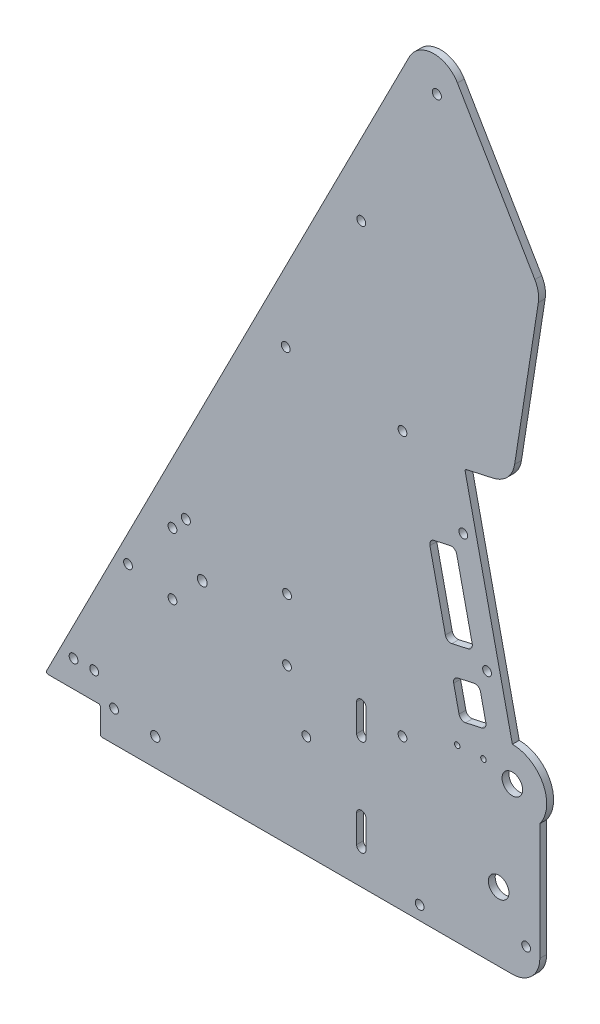
from build123d import *

# Parameters (mm, degrees)
BOSS_EXTRUDE1_DEPTH     = 3.175
SKETCH2_R               = 2.0955
SKETCH2_R_2             = 2.286
SKETCH2_R_3             = 2.032
SKETCH2_R_4             = 4.7625
CUT_EXTRUDE1_DEPTH      = 421.976111717
SKETCH7_R               = 2.159
CUT_EXTRUDE2_DEPTH      = 421.976111717
CUT_EXTRUDE3_REACH      = 422.976
SKETCH10_R              = 2.032
FILLET1_R               = 12.7
FILLET2_R               = 0.79375
SKETCH12_R              = 2.032
CUT_EXTRUDE5_DEPTH      = 410.593447353
SKETCH13_R              = 2.032
CUT_EXTRUDE6_DEPTH      = 410.593447353
CUT_EXTRUDE7_DEPTH      = 410.593447353
CUT_EXTRUDE7_DEPTH_BACK = 410.593447353
SKETCH14_R              = 1.27
FILLET3_R               = 2.54


with BuildPart() as part:
    # Sketch1 → Boss-Extrude1 (new body)
    with BuildSketch(Plane.XY):
        with BuildLine():
            Line((228.6, -12.7), (228.6, 53.975))
            ThreePointArc((228.6, 53.975), (230.099031657, 70.599515829), (215.9, 79.375))
            Line((215.9, 79.375), (193.909735224, 178.566674323))
            Line((193.909735224, 178.566674323), (215.607913982, 183.377044743))
            Line((215.607913982, 183.377044743), (228.6, 266.7))
            Line((228.6, 266.7), (178.754725958, 351.413083686))
            Line((178.754725958, 351.413083686), (0, 0))
            Line((0, 0), (25.4, 0))
            Line((25.4, 0), (25.4, -12.7))
            Line((25.4, -12.7), (228.6, -12.7))
        make_face()
    extrude(amount=BOSS_EXTRUDE1_DEPTH)

    # Sketch2 → Cut-Extrude1 (cut, through all)
    with BuildSketch(Plane.XY.offset(3.175)):
        with Locations((64.943150167, 94.057839899)):
            Circle(SKETCH2_R)
        with Locations((180.975, 322.164313376)):
            Circle(SKETCH2_R)
        with Locations((72.544547852, 73.173171402)):
            Circle(SKETCH2_R_2)
        with Locations((193.207821773, 152.394364194)):
            Circle(SKETCH2_R_3)
        with Locations((215.9, 63.5)):
            Circle(SKETCH2_R_4)
        with Locations((173.0375, -6.35)):
            Circle(SKETCH2_R_3)
        with Locations((204.202954161, 102.798527032)):
            Circle(SKETCH2_R_3)
        with Locations((209.55, 19.05)):
            Circle(SKETCH2_R_4)
        with Locations((165.1, 179.3875)):
            Circle(SKETCH2_R_3)
        with Locations((111.724047852, 87.460671402)):
            Circle(SKETCH2_R_3)
        with Locations((111.724047852, 58.885671402)):
            Circle(SKETCH2_R_3)
        with Locations((58.765047852, 58.885671402)):
            Circle(SKETCH2_R_3)
        with Locations((58.765047852, 87.460671402)):
            Circle(SKETCH2_R_3)
    extrude(amount=-CUT_EXTRUDE1_DEPTH, mode=Mode.SUBTRACT)

    # Sketch7 → Cut-Extrude2 (cut, through all)
    with BuildSketch(Plane.XY.offset(3.175)):
        with Locations((50.8, 0)):
            Circle(SKETCH7_R)
        with BuildLine():
            Line((143.891, 3.175), (143.891, 15.875))
            ThreePointArc((143.891, 15.875), (146.05, 18.034), (148.209, 15.875))
            Line((148.209, 15.875), (148.209, 3.175))
            ThreePointArc((148.209, 3.175), (146.05, 1.016), (143.891, 3.175))
        make_face()
        with BuildLine():
            Line((143.891, 47.625), (143.891, 60.325))
            ThreePointArc((143.891, 60.325), (146.05, 62.484), (148.209, 60.325))
            Line((148.209, 60.325), (148.209, 47.625))
            ThreePointArc((148.209, 47.625), (146.05, 45.466), (143.891, 47.625))
        make_face()
    extrude(amount=-CUT_EXTRUDE2_DEPTH, mode=Mode.SUBTRACT)

    # Sketch10 → Cut-Extrude3 (cut, up to next)
    with BuildSketch(Plane.XY.offset(3.175), mode=Mode.PRIVATE) as cut_extrude3_sk1:
        with Locations((120.65, 34.925)):
            Circle(SKETCH10_R)
    cut_extrude3_tool1 = extrude(cut_extrude3_sk1.sketch, amount=-CUT_EXTRUDE3_REACH, mode=Mode.PRIVATE) & part.part
    # Sketch10 → Cut-Extrude3 (cut, up to next)
    with BuildSketch(Plane.XY.offset(3.175), mode=Mode.PRIVATE) as cut_extrude3_sk2:
        with Locations((165.1, 57.15)):
            Circle(SKETCH10_R)
    cut_extrude3_tool2 = extrude(cut_extrude3_sk2.sketch, amount=-CUT_EXTRUDE3_REACH, mode=Mode.PRIVATE) & part.part
    # Sketch10 → Cut-Extrude3 (cut, up to next)
    with BuildSketch(Plane.XY.offset(3.175), mode=Mode.PRIVATE) as cut_extrude3_sk3:
        with Locations((13.046467246, 12.334704411)):
            Circle(SKETCH10_R)
    cut_extrude3_tool3 = extrude(cut_extrude3_sk3.sketch, amount=-CUT_EXTRUDE3_REACH, mode=Mode.PRIVATE) & part.part
    # Sketch10 → Cut-Extrude3 (cut, up to next)
    with BuildSketch(Plane.XY.offset(3.175), mode=Mode.PRIVATE) as cut_extrude3_sk4:
        with Locations((22.571467246, 12.334704411)):
            Circle(SKETCH10_R)
    cut_extrude3_tool4 = extrude(cut_extrude3_sk4.sketch, amount=-CUT_EXTRUDE3_REACH, mode=Mode.PRIVATE) & part.part
    # Sketch10 → Cut-Extrude3 (cut, up to next)
    with BuildSketch(Plane.XY.offset(3.175), mode=Mode.PRIVATE) as cut_extrude3_sk5:
        with Locations((38.211447917, 62.639810909)):
            Circle(SKETCH10_R)
    cut_extrude3_tool5 = extrude(cut_extrude3_sk5.sketch, amount=-CUT_EXTRUDE3_REACH, mode=Mode.PRIVATE) & part.part
    add(cut_extrude3_tool1.solids().sort_by_distance((120.65, 34.925, 3.175))[0], mode=Mode.SUBTRACT)
    add(cut_extrude3_tool2.solids().sort_by_distance((165.1, 57.15, 3.175))[0], mode=Mode.SUBTRACT)
    add(cut_extrude3_tool3.solids().sort_by_distance((13.046467, 12.334704, 3.175))[0], mode=Mode.SUBTRACT)
    add(cut_extrude3_tool4.solids().sort_by_distance((22.571467, 12.334704, 3.175))[0], mode=Mode.SUBTRACT)
    add(cut_extrude3_tool5.solids().sort_by_distance((38.211448, 62.639811, 3.175))[0], mode=Mode.SUBTRACT)

    # Fillet1
    fillet1_edges = [part.edges().sort_by_distance(p)[0] for p in [
        (228.6, -12.7, 1.5875),
        (178.754725958, 351.413083686, 1.5875),
        (215.607913982, 183.377044743, 1.5875),
        (228.6, 266.7, 1.5875),
    ]]
    fillet(fillet1_edges, radius=FILLET1_R)

    # Fillet2
    fillet2_edges = [part.edges().sort_by_distance(p)[0] for p in [
        (25.4, -12.7, 1.5875),
        (25.4, 0, 1.5875),
        (193.909735224, 178.566674323, 1.5875),
        (0, 0, 1.5875),
    ]]
    fillet(fillet2_edges, radius=FILLET2_R)

    # Sketch12 → Cut-Extrude5 (cut, through all)
    with BuildSketch(Plane.XY.offset(3.175)):
        with Locations((31.75, 1.5875)):
            Circle(SKETCH12_R)
        with Locations((173.0375, -6.35)):
            Circle(SKETCH12_R)
        with Locations((222.25, 1.5875)):
            Circle(SKETCH12_R)
    extrude(amount=-CUT_EXTRUDE5_DEPTH, mode=Mode.SUBTRACT)

    # Sketch13 → Cut-Extrude6 (cut, through all)
    with BuildSketch(Plane.XY.offset(3.175)):
        with Locations((111.125, 186.055)):
            Circle(SKETCH13_R)
        with Locations((146.05, 254)):
            Circle(SKETCH13_R)
    extrude(amount=-CUT_EXTRUDE6_DEPTH, mode=Mode.SUBTRACT)

    # Sketch14 → Cut-Extrude7 (cut, two sides: drawn at the far end of the back side and taken through both)
    with BuildSketch(Plane.XY.offset(3.175).offset(-CUT_EXTRUDE7_DEPTH_BACK)):
        with Locations((190.426832263, 66.260948917)):
            Circle(SKETCH14_R)
        with Locations((202.533497378, 66.789537331)):
            Circle(SKETCH14_R)
        Polygon((177.223670315, 142.346588213), (189.622629605, 145.09537131), (197.868978896, 107.898493439), (185.470019606, 105.149710342), align=None)
        Polygon((188.218802703, 92.750751051), (200.617761993, 95.499534148), (204.191180019, 79.380887071), (191.792220729, 76.632103974), align=None)
    extrude(amount=CUT_EXTRUDE7_DEPTH + CUT_EXTRUDE7_DEPTH_BACK, mode=Mode.SUBTRACT)

    # Fillet3
    fillet3_edges = [part.edges().sort_by_distance(p)[0] for p in [
        (200.617761993, 95.499534148, 1.5875),
        (188.218802703, 92.750751051, 1.5875),
        (191.792220729, 76.632103974, 1.5875),
        (204.191180019, 79.380887071, 1.5875),
        (197.868978896, 107.898493439, 1.5875),
        (185.470019606, 105.149710342, 1.5875),
        (177.223670315, 142.346588213, 1.5875),
        (189.622629605, 145.09537131, 1.5875),
    ]]
    fillet(fillet3_edges, radius=FILLET3_R)


solid = part.part
